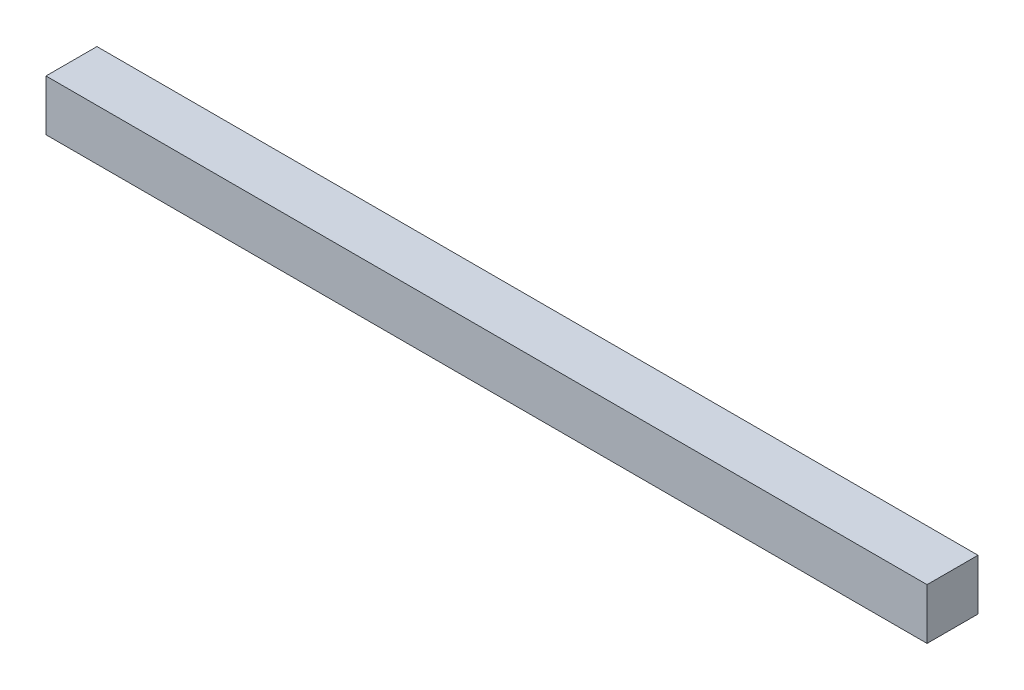
from build123d import *

# Parameters (mm, degrees)
ESQUISSE1_W        = 173
ESQUISSE1_H        = 10
BOSS_EXTRU_1_DEPTH = 10


with BuildPart() as part:
    # Esquisse1 → Boss.-Extru.1 (new body)
    with BuildSketch(Plane.XY):
        with Locations((-1.092703349, 40.545454545)):
            Rectangle(ESQUISSE1_W, ESQUISSE1_H)
    extrude(amount=BOSS_EXTRU_1_DEPTH)


solid = part.part
